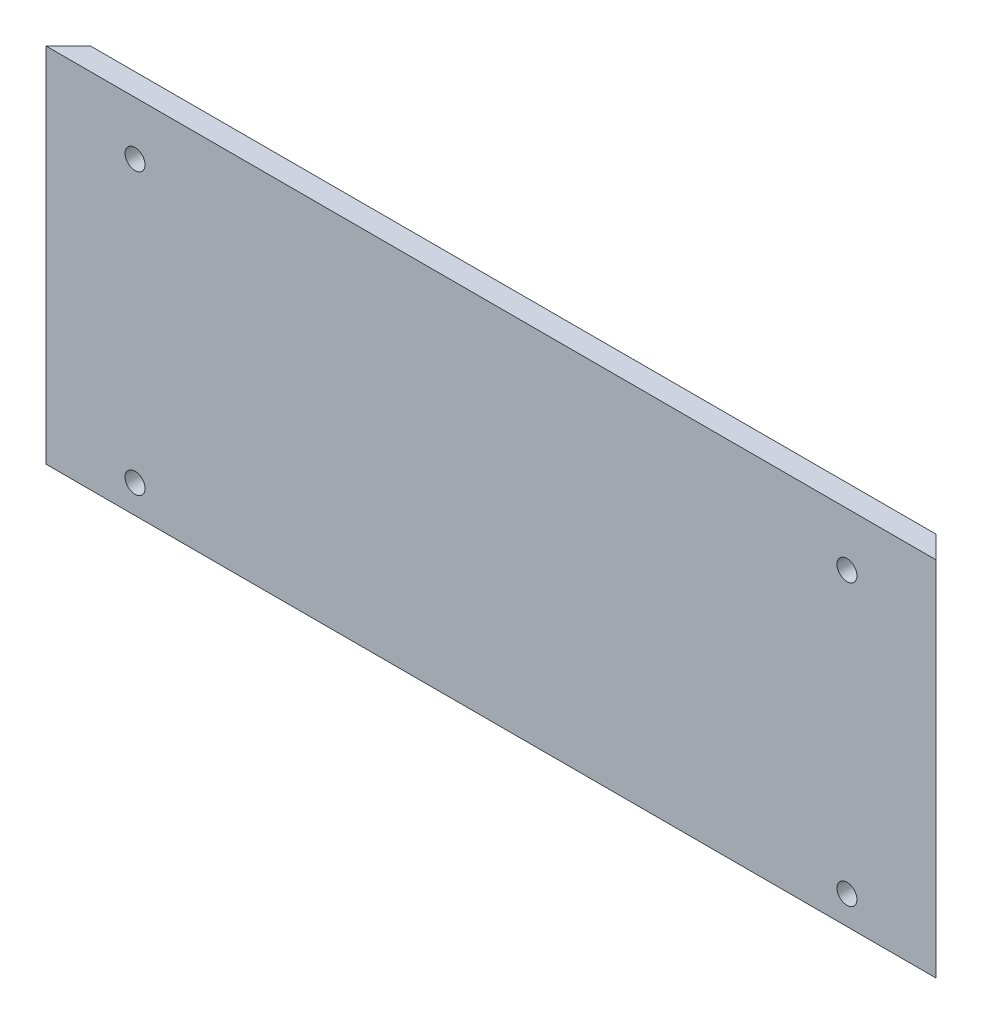
from build123d import *

# Parameters (mm, degrees)
SKETCH1_W           = 200
SKETCH1_H           = 84
SKETCH1_R           = 2.25
BOSS_EXTRUDE1_DEPTH = 5
SKETCH2_W           = 200
SKETCH2_H           = 79
SKETCH2_R           = 2.25
BOSS_EXTRUDE2_DEPTH = 3
CHAMFER1_SIZE       = 8
CHAMFER3_SIZE       = 3
SKETCH3_W           = 7.071067812
SKETCH3_H           = 2.6
CUT_EXTRUDE1_DEPTH  = 234.034075139


with BuildPart() as part:
    # Sketch1 → Boss-Extrude1 (new body)
    with BuildSketch(Plane.XY):
        with Locations((100, 42)):
            Rectangle(SKETCH1_W, SKETCH1_H)
        with Locations((20, 9)):
            Circle(SKETCH1_R, mode=Mode.SUBTRACT)
        with Locations(Location((180, 9, 0), (0, 0, 180))):
            Circle(SKETCH1_R, mode=Mode.SUBTRACT)
        with Locations((20, 72)):
            Circle(SKETCH1_R, mode=Mode.SUBTRACT)
        with Locations(Location((180, 72, 0), (0, 0, 180))):
            Circle(SKETCH1_R, mode=Mode.SUBTRACT)
    extrude(amount=-BOSS_EXTRUDE1_DEPTH)

    # Sketch2 → Boss-Extrude2 (add)
    with BuildSketch(Plane(origin=(0, 0, -5), x_dir=(-1, 0, 0), z_dir=(0, 0, -1))):
        with Locations((-100, 44.5)):
            Rectangle(SKETCH2_W, SKETCH2_H)
        with Locations(Location((-20, 9, 0), (0, 0, 180))):
            Circle(SKETCH2_R, mode=Mode.SUBTRACT)
        with Locations((-180, 9)):
            Circle(SKETCH2_R, mode=Mode.SUBTRACT)
        with Locations(Location((-20, 72, 0), (0, 0, 180))):
            Circle(SKETCH2_R, mode=Mode.SUBTRACT)
        with Locations((-180, 72)):
            Circle(SKETCH2_R, mode=Mode.SUBTRACT)
    extrude(amount=BOSS_EXTRUDE2_DEPTH)

    # Chamfer1
    # the kernel refuses this chamfer: 8 mm, written as the material it takes off along each edge
    with BuildSketch(Plane(origin=(200, -15.573463904, -8), x_dir=(-0.9996219169112968, 0, -0.027495876610586296), z_dir=(0, 1, 0)), Plane(origin=(0, 104.573463904, -8), x_dir=(0.9996219169112968, 0, -0.027495876610586275), z_dir=(0, -1, 0))) as chamfer1_piece_1:
        Polygon((CHAMFER1_SIZE * 0.999621916911, CHAMFER1_SIZE * 0.0274958766106), (-CHAMFER1_SIZE * 0.0274958766106, CHAMFER1_SIZE * 0.999621916911), (0, 0), align=None)
    extrude(amount=120.146927807, mode=Mode.SUBTRACT)

    # Chamfer3
    chamfer3_edges = [part.edges().sort_by_distance(p)[0] for p in [
        (100, 84, -8),
    ]]
    chamfer(chamfer3_edges, length=CHAMFER3_SIZE)

    # Sketch3 → Cut-Extrude1 (cut, through all, along a direction that is not the sketch's normal)
    with BuildSketch(Plane(origin=(100, 0, -100), x_dir=(-0.7071067811865452, 0, -0.7071067811865498), z_dir=(0.7071067811865498, 0, -0.7071067811865452))):
        with Locations((-137.885822331, 1.3)):
            Rectangle(SKETCH3_W, SKETCH3_H)
    extrude(amount=-CUT_EXTRUDE1_DEPTH, dir=(1, 0, 0), mode=Mode.SUBTRACT)


solid = part.part
